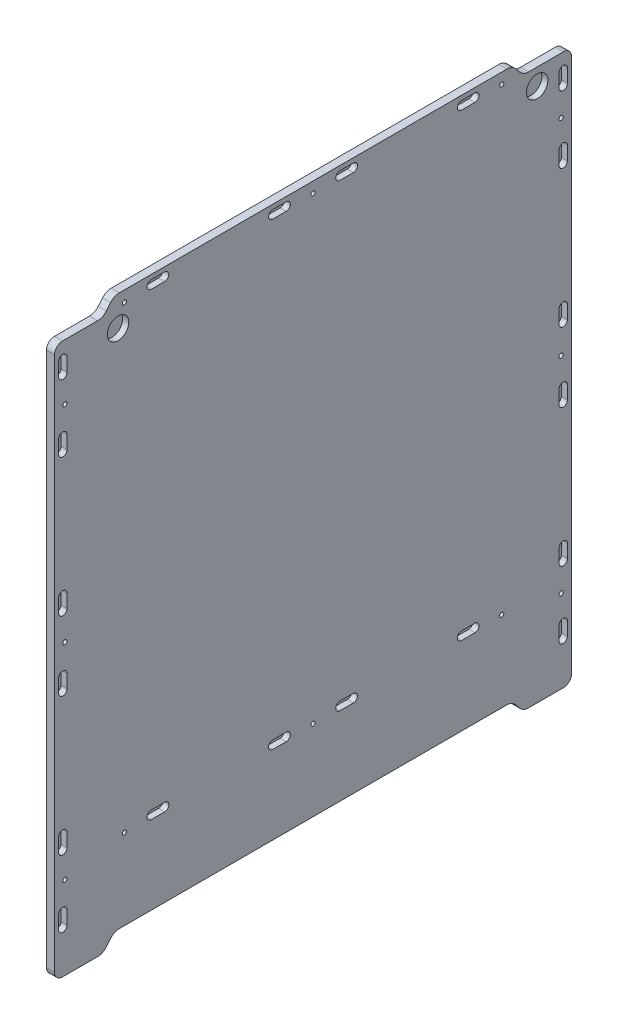
from build123d import *

# Parameters (mm, degrees)
CROQUIS1_R              = 4.25
CROQUIS1_R_2            = 1.55
CROQUIS1_R_3            = 1.6
SALIENTE_EXTRUIR1_DEPTH = 6
CROQUIS3_R              = 8
CORTAR_EXTRUIR1_DEPTH   = 4.5
CHAFL_N1_SIZE           = 1.5
CROQUIS4_W              = 11.100184954
CROQUIS4_H              = 11.272280845
CROQUIS4_W_2            = 11.999327681
SALIENTE_EXTRUIR2_DEPTH = 1.5


with BuildPart() as part:
    # Croquis1 → Saliente-Extruir1 (new body)
    with BuildSketch(Plane(origin=(0, 0, 0), x_dir=(0, 0, -1), z_dir=(1, 0, 0))):
        with BuildLine():
            Line((138.549019323, -203.054493985), (135.2532588, -199.126759542))
            ThreePointArc((135.2532588, -199.126759542), (132.334136258, -196.886838034), (128.741881033, -196.090454224))
            Line((128.741881033, -196.090454224), (-159.54831728, -196.090454224))
            ThreePointArc((-159.54831728, -196.090454224), (-163.140572505, -196.886838034), (-166.059695047, -199.126759542))
            Line((-166.059695047, -199.126759542), (-169.355455569, -203.054493985))
            ThreePointArc((-169.355455569, -203.054493985), (-172.274578058, -205.294415452), (-175.866833217, -206.090799248))
            Line((-175.866833217, -206.090799248), (-201.903218123, -206.090799248))
            ThreePointArc((-201.903218123, -206.090799248), (-206.14585881, -204.333439935), (-207.903218123, -200.090799248))
            Line((-207.903218123, -200.090799248), (-207.903218123, 198.006904316))
            ThreePointArc((-207.903218123, 198.006904316), (-206.14585881, 202.249545003), (-201.903218123, 204.006904316))
            Line((-201.903218123, 204.006904316), (-175.90321816, 204.006904316))
            ThreePointArc((-175.90321816, 204.006904316), (-172.310962954, 204.803288122), (-169.391840427, 207.043209618))
            Line((-169.391840427, 207.043209618), (-166.178352388, 210.872895533))
            ThreePointArc((-166.178352388, 210.872895533), (-163.259229941, 213.112816968), (-159.666974833, 213.909200752))
            Line((-159.666974833, 213.909200752), (128.860538587, 213.909200752))
            ThreePointArc((128.860538587, 213.909200752), (132.452793695, 213.112816968), (135.371916141, 210.872895533))
            Line((135.371916141, 210.872895533), (138.585404181, 207.043209618))
            ThreePointArc((138.585404181, 207.043209618), (141.504526707, 204.803288122), (145.096781914, 204.006904316))
            Line((145.096781914, 204.006904316), (171.096781877, 204.006904316))
            ThreePointArc((171.096781877, 204.006904316), (175.339422564, 202.249545003), (177.096781877, 198.006904316))
            Line((177.096781877, 198.006904316), (177.096781877, -200.090799248))
            ThreePointArc((177.096781877, -200.090799248), (175.339422564, -204.333439935), (171.096781877, -206.090799248))
            Line((171.096781877, -206.090799248), (145.060396971, -206.090799248))
            ThreePointArc((145.060396971, -206.090799248), (141.468141811, -205.294415452), (138.549019323, -203.054493985))
        make_face()
        with Locations((151.496781877, 191.506904316)):
            Circle(CROQUIS1_R, mode=Mode.SUBTRACT)
        with Locations((-160.603218123, 191.506904316)):
            Circle(CROQUIS1_R, mode=Mode.SUBTRACT)
        with Locations((-15.403218123, 205.909200752)):
            Circle(CROQUIS1_R_2, mode=Mode.SUBTRACT)
        with Locations((125.096781877, 205.909200752)):
            Circle(CROQUIS1_R_2, mode=Mode.SUBTRACT)
        with Locations((-155.903218123, 205.909200752)):
            Circle(CROQUIS1_R_2, mode=Mode.SUBTRACT)
        with Locations((-15.403218123, -136.090799248)):
            Circle(CROQUIS1_R_2, mode=Mode.SUBTRACT)
        with Locations((125.096781877, -136.090799248)):
            Circle(CROQUIS1_R_2, mode=Mode.SUBTRACT)
        with Locations((-155.903218123, -136.090799248)):
            Circle(CROQUIS1_R_2, mode=Mode.SUBTRACT)
        with Locations((-200.153218123, 162.206904316)):
            Circle(CROQUIS1_R_3, mode=Mode.SUBTRACT)
        with Locations((-200.153218123, 8.909373264)):
            Circle(CROQUIS1_R_3, mode=Mode.SUBTRACT)
        with Locations((-200.153218123, -144.388157788)):
            Circle(CROQUIS1_R_3, mode=Mode.SUBTRACT)
        with Locations((169.346781877, -144.388157788)):
            Circle(CROQUIS1_R_3, mode=Mode.SUBTRACT)
        with Locations((169.346781877, 8.909373264)):
            Circle(CROQUIS1_R_3, mode=Mode.SUBTRACT)
        with Locations((169.346781877, 162.206904316)):
            Circle(CROQUIS1_R_3, mode=Mode.SUBTRACT)
    extrude(amount=SALIENTE_EXTRUIR1_DEPTH)

    # Croquis3 → Cortar-Extruir1 (cut)
    with BuildSketch(Plane(origin=(6, 0, 0), x_dir=(0, 0, -1), z_dir=(1, 0, 0))):
        with Locations((-160.603218123, 191.506904316)):
            Circle(CROQUIS3_R)
        with Locations((151.496781877, 191.506904316)):
            Circle(CROQUIS3_R)
        with BuildLine():
            Line((-198.603218123, 192.206904316), (-198.603218123, 182.206904316))
            ThreePointArc((-198.603218123, 182.206904316), (-201.703218123, 179.106904316), (-204.803218123, 182.206904316))
            Line((-204.803218123, 182.206904316), (-204.803218123, 192.206904316))
            ThreePointArc((-204.803218123, 192.206904316), (-201.703218123, 195.306904316), (-198.603218123, 192.206904316))
        make_face()
        with BuildLine():
            Line((-198.603218123, 142.206904316), (-198.603218123, 132.206904316))
            ThreePointArc((-198.603218123, 132.206904316), (-201.703218123, 129.106904316), (-204.803218123, 132.206904316))
            Line((-204.803218123, 132.206904316), (-204.803218123, 142.206904316))
            ThreePointArc((-204.803218123, 142.206904316), (-201.703218123, 145.306904316), (-198.603218123, 142.206904316))
        make_face()
        with BuildLine():
            Line((-198.603218123, -124.388157788), (-198.603218123, -114.388157788))
            ThreePointArc((-198.603218123, -114.388157788), (-201.703218123, -111.288157788), (-204.803218123, -114.388157788))
            Line((-204.803218123, -114.388157788), (-204.803218123, -124.388157788))
            ThreePointArc((-204.803218123, -124.388157788), (-201.703218123, -127.488157788), (-198.603218123, -124.388157788))
        make_face()
        with BuildLine():
            Line((-204.803218123, -174.388157788), (-204.803218123, -164.388157788))
            ThreePointArc((-204.803218123, -164.388157788), (-201.703218123, -161.288157788), (-198.603218123, -164.388157788))
            Line((-198.603218123, -164.388157788), (-198.603218123, -174.388157788))
            ThreePointArc((-198.603218123, -174.388157788), (-201.703218123, -177.488157788), (-204.803218123, -174.388157788))
        make_face()
        with BuildLine():
            Line((-198.603218123, 39.767139749), (-198.603218123, 29.767139749))
            ThreePointArc((-198.603218123, 29.767139749), (-201.703218123, 26.667139749), (-204.803218123, 29.767139749))
            Line((-204.803218123, 29.767139749), (-204.803218123, 39.767139749))
            ThreePointArc((-204.803218123, 39.767139749), (-201.703218123, 42.867139749), (-198.603218123, 39.767139749))
        make_face()
        with BuildLine():
            Line((-198.603218123, -11.94839322), (-198.603218123, -21.94839322))
            ThreePointArc((-198.603218123, -21.94839322), (-201.703218123, -25.04839322), (-204.803218123, -21.94839322))
            Line((-204.803218123, -21.94839322), (-204.803218123, -11.94839322))
            ThreePointArc((-204.803218123, -11.94839322), (-201.703218123, -8.84839322), (-198.603218123, -11.94839322))
        make_face()
        with BuildLine():
            Line((167.796781877, -174.388157788), (167.796781877, -164.388157788))
            ThreePointArc((167.796781877, -164.388157788), (170.896781877, -161.288157788), (173.996781877, -164.388157788))
            Line((173.996781877, -164.388157788), (173.996781877, -174.388157788))
            ThreePointArc((173.996781877, -174.388157788), (170.896781877, -177.488157788), (167.796781877, -174.388157788))
        make_face()
        with BuildLine():
            Line((173.996781877, -124.388157788), (173.996781877, -114.388157788))
            ThreePointArc((173.996781877, -114.388157788), (170.896781877, -111.288157788), (167.796781877, -114.388157788))
            Line((167.796781877, -114.388157788), (167.796781877, -124.388157788))
            ThreePointArc((167.796781877, -124.388157788), (170.896781877, -127.488157788), (173.996781877, -124.388157788))
        make_face()
        with BuildLine():
            Line((173.996781877, -11.94839322), (173.996781877, -21.94839322))
            ThreePointArc((173.996781877, -21.94839322), (170.896781877, -25.04839322), (167.796781877, -21.94839322))
            Line((167.796781877, -21.94839322), (167.796781877, -11.94839322))
            ThreePointArc((167.796781877, -11.94839322), (170.896781877, -8.84839322), (173.996781877, -11.94839322))
        make_face()
        with BuildLine():
            Line((173.996781877, 39.767139749), (173.996781877, 29.767139749))
            ThreePointArc((173.996781877, 29.767139749), (170.896781877, 26.667139749), (167.796781877, 29.767139749))
            Line((167.796781877, 29.767139749), (167.796781877, 39.767139749))
            ThreePointArc((167.796781877, 39.767139749), (170.896781877, 42.867139749), (173.996781877, 39.767139749))
        make_face()
        with BuildLine():
            Line((-45.403218123, 210.509200752), (-35.403218123, 210.509200752))
            ThreePointArc((-35.403218123, 210.509200752), (-32.303218123, 207.409200752), (-35.403218123, 204.309200752))
            Line((-35.403218123, 204.309200752), (-45.403218123, 204.309200752))
            ThreePointArc((-45.403218123, 204.309200752), (-48.503218123, 207.409200752), (-45.403218123, 210.509200752))
        make_face()
        with BuildLine():
            Line((-135.903218123, 210.509200752), (-125.903218123, 210.509200752))
            ThreePointArc((-125.903218123, 210.509200752), (-122.803218123, 207.409200752), (-125.903218123, 204.309200752))
            Line((-125.903218123, 204.309200752), (-135.903218123, 204.309200752))
            ThreePointArc((-135.903218123, 204.309200752), (-139.003218123, 207.409200752), (-135.903218123, 210.509200752))
        make_face()
        with BuildLine():
            Line((105.096781877, 204.309200752), (95.096781877, 204.309200752))
            ThreePointArc((95.096781877, 204.309200752), (91.996781877, 207.409200752), (95.096781877, 210.509200752))
            Line((95.096781877, 210.509200752), (105.096781877, 210.509200752))
            ThreePointArc((105.096781877, 210.509200752), (108.196781877, 207.409200752), (105.096781877, 204.309200752))
        make_face()
        with BuildLine():
            Line((14.596781877, 204.309200752), (4.596781877, 204.309200752))
            ThreePointArc((4.596781877, 204.309200752), (1.496781877, 207.409200752), (4.596781877, 210.509200752))
            Line((4.596781877, 210.509200752), (14.596781877, 210.509200752))
            ThreePointArc((14.596781877, 210.509200752), (17.696781877, 207.409200752), (14.596781877, 204.309200752))
        make_face()
        with BuildLine():
            Line((-135.903218123, -131.490799248), (-125.903218123, -131.490799248))
            ThreePointArc((-125.903218123, -131.490799248), (-122.803218123, -134.590799248), (-125.903218123, -137.690799248))
            Line((-125.903218123, -137.690799248), (-135.903218123, -137.690799248))
            ThreePointArc((-135.903218123, -137.690799248), (-139.003218123, -134.590799248), (-135.903218123, -131.490799248))
        make_face()
        with BuildLine():
            Line((-45.403218123, -131.490799248), (-35.403218123, -131.490799248))
            ThreePointArc((-35.403218123, -131.490799248), (-32.303218123, -134.590799248), (-35.403218123, -137.690799248))
            Line((-35.403218123, -137.690799248), (-45.403218123, -137.690799248))
            ThreePointArc((-45.403218123, -137.690799248), (-48.503218123, -134.590799248), (-45.403218123, -131.490799248))
        make_face()
        with BuildLine():
            Line((14.596781877, -131.490799248), (4.596781877, -131.490799248))
            ThreePointArc((4.596781877, -131.490799248), (1.496781877, -134.590799248), (4.596781877, -137.690799248))
            Line((4.596781877, -137.690799248), (14.596781877, -137.690799248))
            ThreePointArc((14.596781877, -137.690799248), (17.696781877, -134.590799248), (14.596781877, -131.490799248))
        make_face()
        with BuildLine():
            Line((105.096781877, -131.490799248), (95.096781877, -131.490799248))
            ThreePointArc((95.096781877, -131.490799248), (91.996781877, -134.590799248), (95.096781877, -137.690799248))
            Line((95.096781877, -137.690799248), (105.096781877, -137.690799248))
            ThreePointArc((105.096781877, -137.690799248), (108.196781877, -134.590799248), (105.096781877, -131.490799248))
        make_face()
        with BuildLine():
            Line((173.996781877, 142.206904316), (173.996781877, 132.206904316))
            ThreePointArc((173.996781877, 132.206904316), (170.896781877, 129.106904316), (167.796781877, 132.206904316))
            Line((167.796781877, 132.206904316), (167.796781877, 142.206904316))
            ThreePointArc((167.796781877, 142.206904316), (170.896781877, 145.306904316), (173.996781877, 142.206904316))
        make_face()
        with BuildLine():
            Line((173.996781877, 192.206904316), (173.996781877, 182.206904316))
            ThreePointArc((173.996781877, 182.206904316), (170.896781877, 179.106904316), (167.796781877, 182.206904316))
            Line((167.796781877, 182.206904316), (167.796781877, 192.206904316))
            ThreePointArc((167.796781877, 192.206904316), (170.896781877, 195.306904316), (173.996781877, 192.206904316))
        make_face()
    extrude(amount=-CORTAR_EXTRUIR1_DEPTH, mode=Mode.SUBTRACT)

    # Chaflán1
    chafl_n1_edges = [part.edges().sort_by_distance(p)[0] for p in [
        (0, 205.909200752, 16.953218123),
        (0, 205.909200752, -123.546781877),
        (0, -136.090799248, -123.546781877),
        (0, -136.090799248, 16.953218123),
        (0, -136.090799248, 157.453218123),
        (0, 162.206904316, 201.753218123),
        (0, 205.909200752, 157.453218123),
        (0, 162.206904316, -167.746781877),
        (0, 8.909373264, -167.746781877),
        (0, -144.388157788, -167.746781877),
        (0, -144.388157788, 201.753218123),
        (0, 8.909373264, 201.753218123),
    ]]
    chamfer(chafl_n1_edges, length=CHAFL_N1_SIZE)

    # Croquis4 → Saliente-Extruir2 (add)
    with BuildSketch(Plane.ZY):
        with Locations((-151.595226522, 191.649895838)):
            Rectangle(CROQUIS4_W, CROQUIS4_H)
        with Locations((160.735035587, 191.649895838)):
            Rectangle(CROQUIS4_W_2, CROQUIS4_H)
    extrude(amount=-SALIENTE_EXTRUIR2_DEPTH)


solid = part.part
